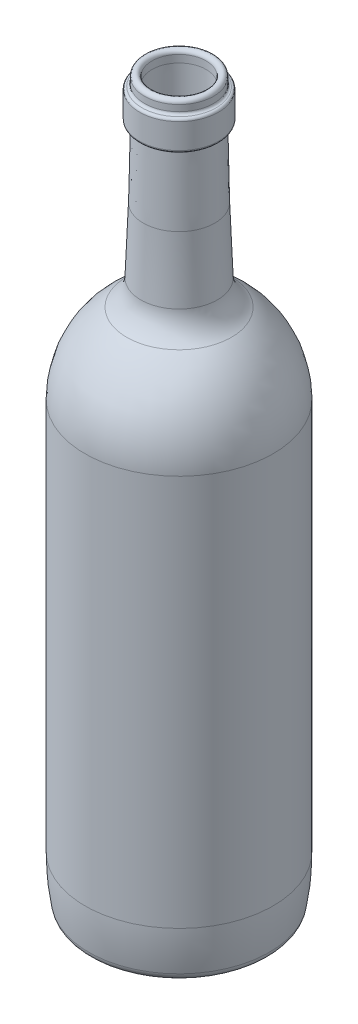
from build123d import *


with BuildPart() as part:
    # Skica1 → Rotovat1 (revolve)
    with BuildSketch(Plane.XY):
        with BuildLine():
            Line((-8.477605797, 6.777251432), (-30.929584255, 0.163033142))
            ThreePointArc((-30.929584255, 0.163033142), (-34.169375848, 0.601434808), (-36, 3.310172669))
            ThreePointArc((-36, 3.310172669), (-37.086818531, 11.623651805), (-37.45, 20))
            Line((-37.45, 20), (-37.45, 176))
            ThreePointArc((-37.45, 176), (-33.058133011, 193.979909051), (-20.871685667, 207.910311999))
            ThreePointArc((-20.871685667, 207.910311999), (-16.90629883, 212.311877092), (-15.25, 218))
            ThreePointArc((-15.25, 218), (-14.620475493, 230.995018288), (-14.25, 244))
            Line((-14.25, 244), (-13.75, 271))
            ThreePointArc((-13.75, 271), (-14.036265703, 271.719106541), (-14.75, 272.018515329))
            ThreePointArc((-14.75, 272.018515329), (-15.457096382, 272.311297739), (-15.75, 273.01834392))
            Line((-15.75, 273.01834392), (-15.75, 283.01834392))
            ThreePointArc((-15.75, 283.01834392), (-15.457106781, 283.725450702), (-14.75, 284.01834392))
            ThreePointArc((-14.75, 284.01834392), (-14.042893219, 284.311237139), (-13.75, 285.01834392))
            Line((-13.75, 285.01834392), (-13.75, 287.5))
            ThreePointArc((-13.75, 287.5), (-12.25, 289), (-10.75, 287.5))
            Line((-10.75, 287.5), (-10.783702507, 284.500189316))
            Line((-10.783702507, 284.500189316), (-10.750514271, 270.944453968))
            Line((-10.750514271, 270.944453968), (-11.250514271, 243.944453968))
            ThreePointArc((-11.250514271, 243.944453968), (-11.622691969, 230.879718922), (-12.255108921, 217.824993078))
            ThreePointArc((-12.255108921, 217.824993078), (-14.285626713, 210.851713519), (-19.146940615, 205.455672614))
            ThreePointArc((-19.146940615, 205.455672614), (-30.395968933, 192.596839124), (-34.45, 176))
            Line((-34.45, 176), (-34.45, 20))
            ThreePointArc((-34.45, 20), (-34.098076849, 11.883311498), (-33.044948771, 3.827543167))
            ThreePointArc((-33.044948771, 3.827543167), (-32.587292733, 3.150358702), (-31.777344834, 3.040758286))
            Line((-31.777344834, 3.040758286), (-9.325366377, 9.654976575))
            ThreePointArc((-9.325366377, 9.654976575), (-4.710932659, 10.66201331), (0, 11))
            Line((0, 11), (0, 8))
            ThreePointArc((0, 8), (-4.282666054, 7.692739373), (-8.477605797, 6.777251432))
        make_face()
    revolve(axis=Axis((0, 0, 0), (0, 1, 0)))


solid = part.part
